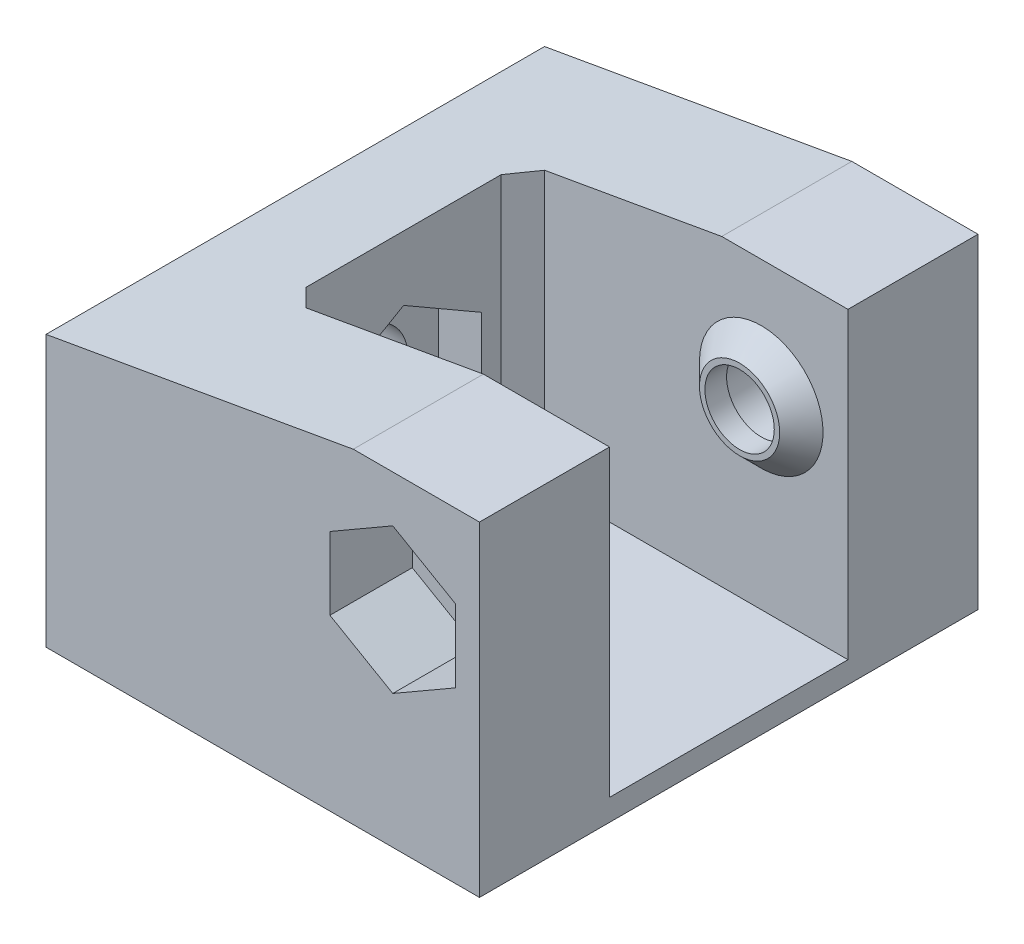
from build123d import *

# Parameters (mm, degrees)
SKETCH1_W               = 23
SKETCH1_H               = 15
BOSS_EXTRUDE1_DEPTH     = 20
SKETCH2_W               = 11
SKETCH2_H               = 15
CUT_EXTRUDE1_DEPTH      = 15
CUT_EXTRUDE2_DEPTH      = 34.970575503
CUT_EXTRUDE2_DEPTH_BACK = 34.970575503
SKETCH3_R               = 1.7
CHAMFER1_SIZE           = 2.5
CHAMFER1_SIZE_2         = 14.178204549
SKETCH4_R               = 2.2
CUT_EXTRUDE3_DEPTH      = 10
CUT_EXTRUDE4_DEPTH      = 2
SKETCH6_R               = 3.25
CUT_EXTRUDE5_DEPTH      = 2.5
CUT_EXTRUDE6_DEPTH      = 3.8
CHAMFER3_SIZE           = 1
SKETCH9_R               = 1.85
SKETCH9_R_2             = 1.6
BOSS_EXTRUDE2_DEPTH     = 1
BOSS_EXTRUDE3_START     = 1
SKETCH8_R               = 1.85
SKETCH8_R_2             = 1.600864578
BOSS_EXTRUDE3_DEPTH     = 1
CHAMFER4_SIZE           = 1
BOSS_EXTRUDE4_START     = -17
SKETCH10_W              = 20
SKETCH10_H              = 1
BOSS_EXTRUDE4_DEPTH     = 11


# Some blends are built 0.0001 mm under size
with BuildPart() as part:
    # Sketch1 → Boss-Extrude1 (new body)
    with BuildSketch(Plane(origin=(0, 0, 0), x_dir=(0, 0, -1), z_dir=(1, 0, 0))):
        with Locations((11.5, 7.5)):
            Rectangle(SKETCH1_W, SKETCH1_H)
    extrude(amount=BOSS_EXTRUDE1_DEPTH)

    # Sketch2 → Cut-Extrude1 (cut)
    with BuildSketch(Plane(origin=(20, 0, 0), x_dir=(0, 0, -1), z_dir=(1, 0, 0))):
        with Locations((11.5, 7.5)):
            Rectangle(SKETCH2_W, SKETCH2_H)
    extrude(amount=-CUT_EXTRUDE1_DEPTH, mode=Mode.SUBTRACT)

    # Sketch3 → Cut-Extrude2 (cut, two sides: drawn at the far end of the back side and taken through both)
    with BuildSketch(Plane(origin=(0, 0, -23), x_dir=(-1, 0, 0), z_dir=(0, 0, -1)).offset(-CUT_EXTRUDE2_DEPTH_BACK)):
        with Locations(Location((-16, 9.5, 0), (0, 0, 90))):
            Circle(SKETCH3_R)
    extrude(amount=CUT_EXTRUDE2_DEPTH + CUT_EXTRUDE2_DEPTH_BACK, mode=Mode.SUBTRACT)

    # Chamfer1
    # the kernel refuses this chamfer: 14.178204549, 2.5 mm, written as the material it takes off along each edge
    with BuildSketch(Plane(origin=(0, 15, -59.842614584), x_dir=(-0.21013876076743537, -0.9776715712462578, 0), z_dir=(0, 0, 1))) as chamfer1_piece_1:
        Polygon((CHAMFER1_SIZE * 0.977671571246, CHAMFER1_SIZE * 0.210138760767), (-CHAMFER1_SIZE_2 * 0.210138760768, CHAMFER1_SIZE_2 * 0.977671571249), (0, 0), align=None)
    extrude(amount=96.685229169, mode=Mode.SUBTRACT)

    # Sketch4 → Cut-Extrude3 (cut)
    with BuildSketch(Plane.ZY):
        with Locations((-11.5, 6.25)):
            Circle(SKETCH4_R)
    extrude(amount=-CUT_EXTRUDE3_DEPTH, mode=Mode.SUBTRACT)

    # Sketch5 → Cut-Extrude4 (cut)
    with BuildSketch(Plane(origin=(5, 0, 0), x_dir=(0, 0, -1), z_dir=(1, 0, 0))):
        Polygon((7.9, 8.328460969), (7.9, 4.171539031), (11.5, 2.093078062), (15.1, 4.171539031), (15.1, 8.328460969), (11.5, 10.406921938), align=None)
    extrude(amount=-CUT_EXTRUDE4_DEPTH, mode=Mode.SUBTRACT)

    # Sketch6 → Cut-Extrude5 (cut)
    with BuildSketch(Plane(origin=(0, 0, -23), x_dir=(-1, 0, 0), z_dir=(0, 0, -1))):
        with Locations((-16, 9.5)):
            Circle(SKETCH6_R)
    extrude(amount=-CUT_EXTRUDE5_DEPTH, mode=Mode.SUBTRACT)

    # Sketch7 → Cut-Extrude6 (cut)
    with BuildSketch(Plane.XY):
        Polygon((13.1, 11.174315781), (13.1, 7.825684219), (16, 6.151368439), (18.9, 7.825684219), (18.9, 11.174315781), (16, 12.848631561), align=None)
    extrude(amount=-CUT_EXTRUDE6_DEPTH, mode=Mode.SUBTRACT)

    # Chamfer3
    chamfer3_edges = [part.edges().sort_by_distance(p)[0] for p in [
        (5, 6.690817452, -17),
        (5, 6.690817452, -6),
    ]]
    chamfer(chamfer3_edges, length=CHAMFER3_SIZE)

    # Sketch9 → Boss-Extrude2 (add)
    with BuildSketch(Plane(origin=(0, 0, -6), x_dir=(-1, 0, 0), z_dir=(0, 0, -1))):
        with Locations(Location((-16, 9.5, 0), (0, 0, 270))):
            Circle(SKETCH9_R)
        with Locations(Location((-16, 9.5, 0), (0, 0, 90))):
            Circle(SKETCH9_R_2, mode=Mode.SUBTRACT)
    extrude(amount=BOSS_EXTRUDE2_DEPTH)

    # Sketch8 → Boss-Extrude3 (add)
    with BuildSketch(Plane.XY.offset(-17).offset(BOSS_EXTRUDE3_START)):
        with Locations(Location((16, 9.5, 0), (0, 0, 270))):
            Circle(SKETCH8_R)
        with Locations((16, 9.5)):
            Circle(SKETCH8_R_2, mode=Mode.SUBTRACT)
    extrude(amount=-BOSS_EXTRUDE3_DEPTH)

    # Chamfer4
    chamfer4_edges = [part.edges().sort_by_distance(p)[0] for p in [
        (16, 11.35, -6),
        (16, 11.35, -17),
    ]]
    chamfer(chamfer4_edges, length=CHAMFER4_SIZE - 0.0001)  # a hair under: the kernel refuses the full size

    # Sketch10 → Boss-Extrude4 (add)
    with BuildSketch(Plane(origin=(0, 0, -23), x_dir=(-1, 0, 0), z_dir=(0, 0, -1)).offset(BOSS_EXTRUDE4_START)):
        with Locations((-10, 0.5)):
            Rectangle(SKETCH10_W, SKETCH10_H)
    extrude(amount=BOSS_EXTRUDE4_DEPTH)


solid = part.part
